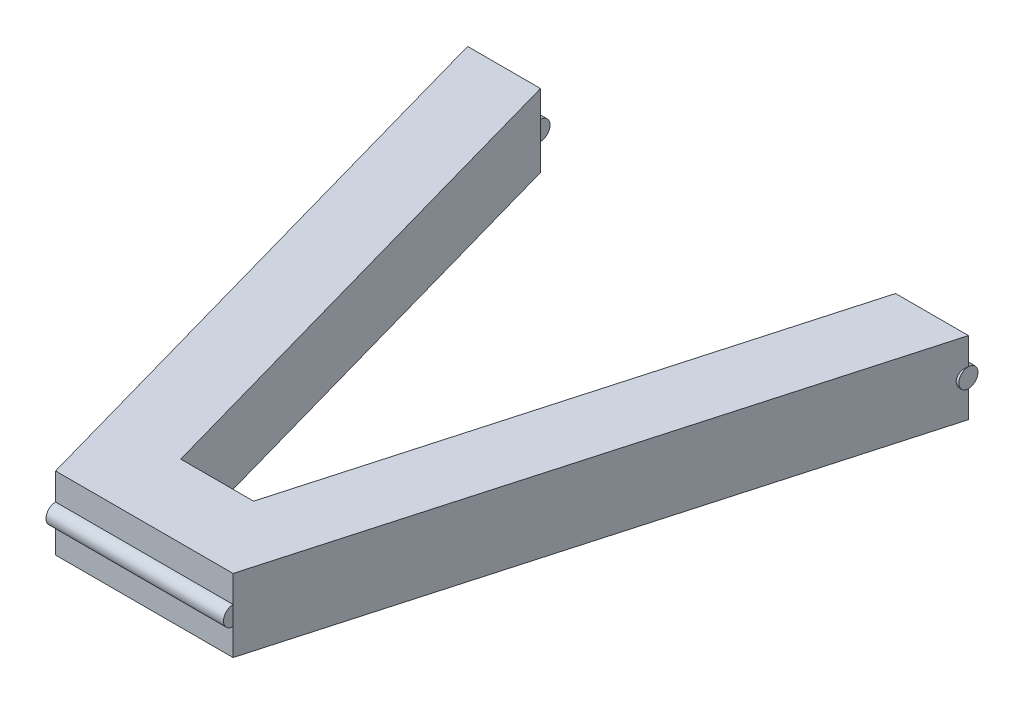
from build123d import *

# Parameters (mm, degrees)
BOSS_EXTRUDE1_DEPTH = 38.1
SWEEP1_PROFILE_R    = 5
SWEEP2_PROFILE_R    = 5
SWEEP4_PROFILE_R    = 5
SHELL4_START        = 5
SHELL4_DEPTH        = 28.1


# Read off the part's stored shape, not the designer's step: Shell4
with BuildPart() as part:
    # Sketch1 → Boss-Extrude1 (new body)
    with BuildSketch(Plane(origin=(0, 0, 0), x_dir=(1, 0, 0), z_dir=(0, 1, 0))):
        Polygon((111.9, 0), (150, 0), (177.363917526, 0), (261.9, 300), (223.8, 300), (150, 38.1), (111.9, 38.1), (38.1, 300), (0, 300), (84.536082474, 0), align=None)
    extrude(amount=BOSS_EXTRUDE1_DEPTH)

    # Sweep1: sweep along a path in Sketch2
    with BuildLine(Plane.XY) as sweep1_path:
        Line((84.536082474, 19.05), (177.363917526, 19.05))
    # Sweep1 profile (on start of the path) → Sweep1 (sweep)
    with BuildSketch(Plane(origin=(84.536082474, 19.05, 0), x_dir=(0, 0, 1), z_dir=(1, 0, 0))):
        Circle(SWEEP1_PROFILE_R)
    sweep(path=sweep1_path.line)

    # Sweep2: sweep along a path in Sketch11
    with BuildLine(Plane(origin=(0, 0, -300), x_dir=(-1, 0, 0), z_dir=(0, 0, -1))) as sweep2_path:
        Line((0, 19.05), (-38.1, 19.05))
    # Sweep2 profile (on start of the path) → Sweep2 (sweep)
    with BuildSketch(Plane(origin=(0, 19.05, -300), x_dir=(0, 0, 1), z_dir=(1, 0, 0))):
        Circle(SWEEP2_PROFILE_R)
    sweep(path=sweep2_path.line)

    # Sweep4: sweep along a path in Sketch16
    with BuildLine(Plane(origin=(0, 0, -300), x_dir=(-1, 0, 0), z_dir=(0, 0, -1))) as sweep4_path:
        Line((-261.9, 19.05), (-223.8, 19.05))
    # Sweep4 profile (on start of the path) → Sweep4 (sweep)
    with BuildSketch(Plane(origin=(261.9, 19.05, -300), x_dir=(0, 0, -1), z_dir=(-1, 0, 0))):
        Circle(SWEEP4_PROFILE_R)
    sweep(path=sweep4_path.line)

    # Shell4 outline → Shell4 (cut)
    with BuildSketch(Plane(origin=(0, 0, 0), x_dir=(1, 0, 0), z_dir=(0, 1, 0)).offset(SHELL4_START)):
        Polygon((255.296347108, 295), (227.585783476, 295), (153.785783476, 33.1), (108.114216524, 33.1), (34.314216524, 295), (6.603652892, 295), (88.32186595, 5), (173.57813405, 5), align=None)
    extrude(amount=SHELL4_DEPTH, mode=Mode.SUBTRACT)


solid = part.part
